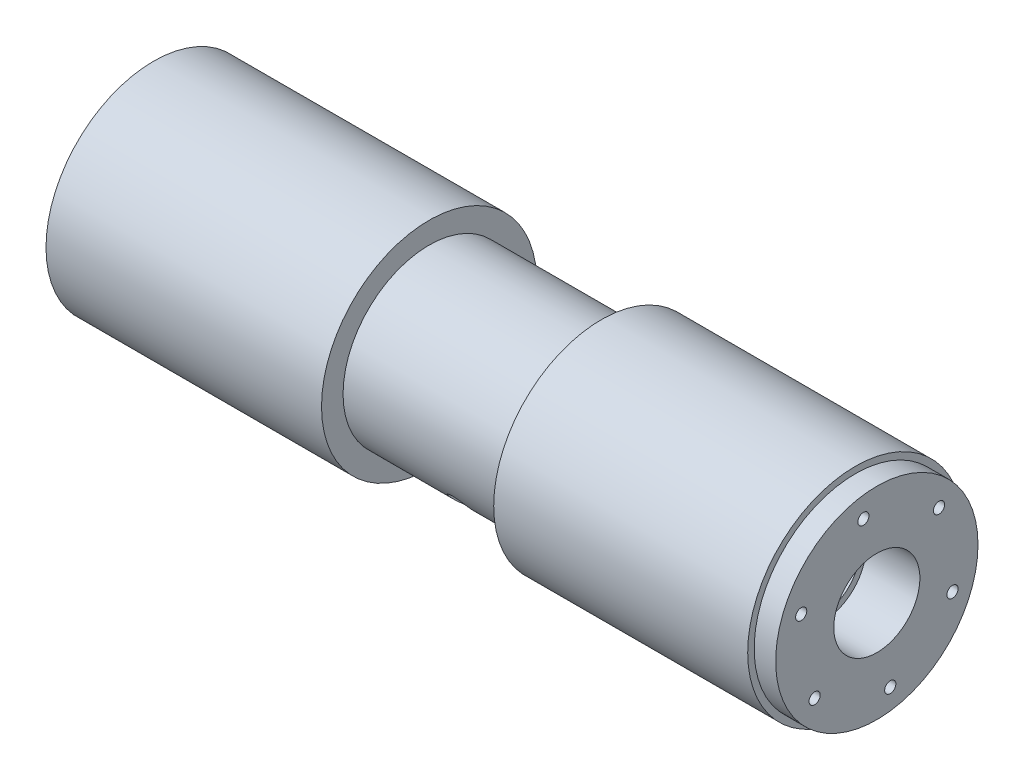
from build123d import *

# Parameters (mm, degrees)
SKETCH1_R                 = 31.75
SKETCH1_R_2               = 10.795
BOSS_EXTRUDE1_DEPTH       = 106.68
SKETCH2_R                 = 12.7
CUT_EXTRUDE1_DEPTH        = 15.875
CUT_EXTRUDE2_START        = -81.28
SKETCH3_OUTSIDE_W         = 111.798
SKETCH3_OUTSIDE_H         = 111.798
SKETCH3_OUTSIDE_R         = 25.4
CUT_EXTRUDE2_DEPTH        = 50.8
CUT_EXTRUDE3_DEPTH        = 25.4
CUT_EXTRUDE3_DEPTH_BACK   = 25.4
SKETCH5_R                 = 3.175
M4X0_7_TAPPED_HOLE1_D     = 3.3
M4X0_7_TAPPED_HOLE1_DEPTH = 9.906
M4X0_7_TAPPED_HOLE1_TIP   = 0.991420021
SKETCH11_OUTSIDE_W        = 111.798
SKETCH11_OUTSIDE_H        = 111.798
SKETCH11_OUTSIDE_R        = 29.845
CUT_EXTRUDE4_DEPTH        = 6.35


with BuildPart() as part:
    # Sketch1 → Boss-Extrude1 (new body)
    with BuildSketch(Plane(origin=(0, 0, 0), x_dir=(0, 0, -1), z_dir=(1, 0, 0))):
        Circle(SKETCH1_R)
        Circle(SKETCH1_R_2, mode=Mode.SUBTRACT)
    boss_extrude1 = extrude(amount=BOSS_EXTRUDE1_DEPTH)

    # Sketch2 → Cut-Extrude1 (cut)
    with BuildSketch(Plane.ZY):
        Circle(SKETCH2_R)
    cut_extrude1 = extrude(amount=-CUT_EXTRUDE1_DEPTH, mode=Mode.SUBTRACT)

    # Mirror1: Boss-Extrude1, Cut-Extrude1 across plane
    add(boss_extrude1.mirror(Plane(origin=(106.68, 0, 0), x_dir=(0, 0, 1), z_dir=(1, 0, 0))))
    add(cut_extrude1.mirror(Plane(origin=(106.68, 0, 0), x_dir=(0, 0, 1), z_dir=(1, 0, 0))), mode=Mode.SUBTRACT)

    # Sketch3 outside → Cut-Extrude2 (cut)
    with BuildSketch(Plane.ZY.offset(CUT_EXTRUDE2_START)):
        Rectangle(SKETCH3_OUTSIDE_W, SKETCH3_OUTSIDE_H)
        Circle(SKETCH3_OUTSIDE_R, mode=Mode.SUBTRACT)
    extrude(amount=-CUT_EXTRUDE2_DEPTH, mode=Mode.SUBTRACT)

    # Sketch5 → Cut-Extrude3 (cut, two sides: drawn at the far end of the back side and taken through both)
    with BuildSketch(Plane.XY.offset(-CUT_EXTRUDE3_DEPTH_BACK)):
        with Locations((109.22, -17.4625)):
            Circle(SKETCH5_R)
    extrude(amount=CUT_EXTRUDE3_DEPTH + CUT_EXTRUDE3_DEPTH_BACK, mode=Mode.SUBTRACT)

    # M4x0.7 Tapped Hole1
    with Locations(Plane(origin=(213.36, 0, 0), x_dir=(0, 0, -1), z_dir=(1, 0, 0))):
        with Locations((22.316260429, -8.307808178), (3.963357283, -23.480352538), (18.352903146, 15.17254436), (-3.963357283, 23.480352538), (-22.316260429, 8.307808178), (-18.352903146, -15.17254436)):
            Hole(M4X0_7_TAPPED_HOLE1_D / 2, depth=M4X0_7_TAPPED_HOLE1_DEPTH)
            with Locations((0, 0, -(M4X0_7_TAPPED_HOLE1_DEPTH + M4X0_7_TAPPED_HOLE1_TIP / 2))):  # 118° drill point
                Cone(0, M4X0_7_TAPPED_HOLE1_D / 2, M4X0_7_TAPPED_HOLE1_TIP, mode=Mode.SUBTRACT)

    # Sketch11 outside → Cut-Extrude4 (cut)
    with BuildSketch(Plane(origin=(213.36, 0, 0), x_dir=(0, 0, -1), z_dir=(1, 0, 0))):
        Rectangle(SKETCH11_OUTSIDE_W, SKETCH11_OUTSIDE_H)
        Circle(SKETCH11_OUTSIDE_R, mode=Mode.SUBTRACT)
    extrude(amount=-CUT_EXTRUDE4_DEPTH, mode=Mode.SUBTRACT)


solid = part.part
